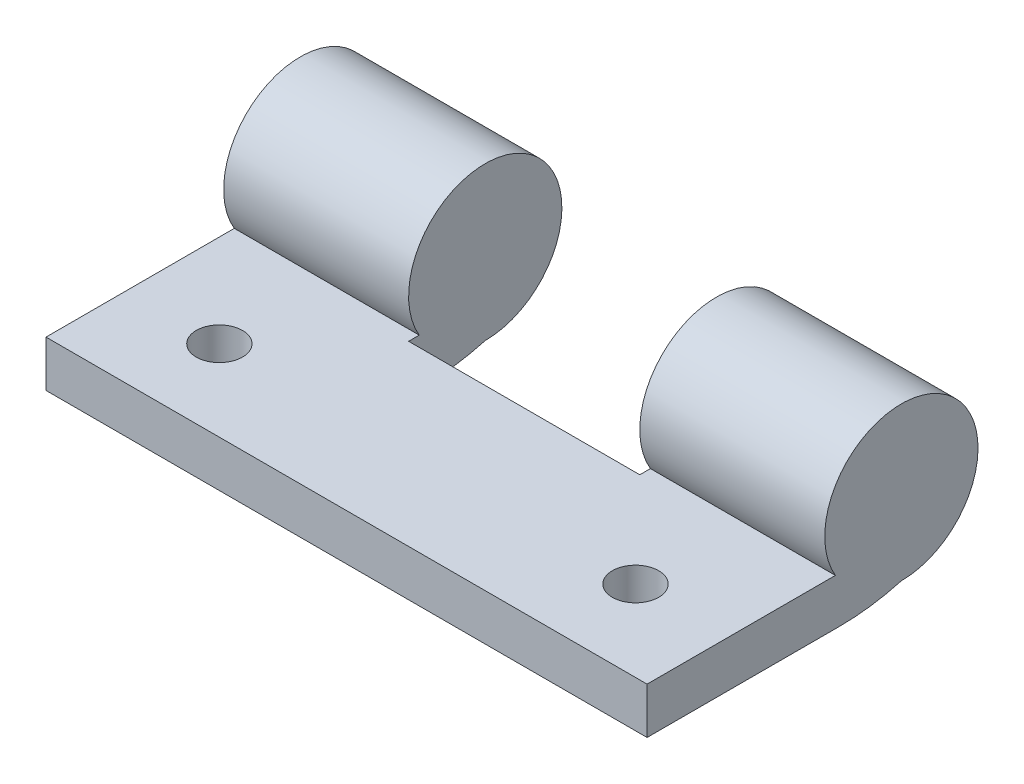
from build123d import *

# Parameters (mm, degrees)
SKETCH_1_W               = 26
SKETCH_1_H               = 11
SKETCH_1_R               = 1
EXTRUDE_1_DEPTH          = 2
SKETCH_2_R               = 3.315
EXTRUDE_2_DEPTH          = 26
FILLET_1_R               = 10
CUT_EXTRUDE_1_DEPTH      = 18.748239349
CUT_EXTRUDE_1_DEPTH_BACK = 18.748239349
SKETCH_3_W               = 10
SKETCH_3_H               = 7


with BuildPart() as part:
    # 草图1 → 凸台-拉伸1 (new body)
    with BuildSketch(Plane(origin=(0, 0, 0), x_dir=(1, 0, 0), z_dir=(0, 1, 0))):
        with Locations((0, -5.5)):
            Rectangle(SKETCH_1_W, SKETCH_1_H)
        with Locations(Location((9, -7.5, 0), (0, 0, 270))):
            Circle(SKETCH_1_R, mode=Mode.SUBTRACT)
        with Locations(Location((-9, -7.5, 0), (0, 0, 90))):
            Circle(SKETCH_1_R, mode=Mode.SUBTRACT)
    extrude(amount=EXTRUDE_1_DEPTH)

    # 草图2 → 凸台-拉伸2 (add)
    with BuildSketch(Plane(origin=(13, 0, 0), x_dir=(0, 0, -1), z_dir=(1, 0, 0))):
        with Locations((0, 3.685)):
            Circle(SKETCH_2_R)
    extrude(amount=-EXTRUDE_2_DEPTH)

    # 圆角1
    # the kernel refuses this fillet: 10 mm, written as the material it takes off along each edge
    with BuildSketch(Plane(origin=(19.737534787, 0, 0), x_dir=(0, 1, 0), z_dir=(-1, 0, 0))) as fillet_1_piece_1:
        with BuildLine():
            CenterArc((10, -2.695013915), FILLET_1_R, 164.365401099, 15.634598901)
            Line((0, -2.695013915), (-0.2, -2.695013915))
            Line((-0.2, -2.695013915), (-0.2, 0))
            Line((-0.2, 0), (0, 0.2))
            ThreePointArc((0, 0.2), (0.185, 0.2), (0.1774, 0.053900278))
            Line((0.1774, 0.053900278), (0.37, 0))
        make_face()
    extrude(amount=39.475069573, mode=Mode.SUBTRACT)

    # 草图3 → 切除-拉伸1 (cut, two sides: drawn at the far end of the back side and taken through both)
    with BuildSketch(Plane(origin=(0, 2, 0), x_dir=(1, 0, 0), z_dir=(0, 1, 0)).offset(-CUT_EXTRUDE_1_DEPTH_BACK)):
        with Locations((0, 0.185)):
            Rectangle(SKETCH_3_W, SKETCH_3_H)
    extrude(amount=CUT_EXTRUDE_1_DEPTH + CUT_EXTRUDE_1_DEPTH_BACK, mode=Mode.SUBTRACT)


solid = part.part
